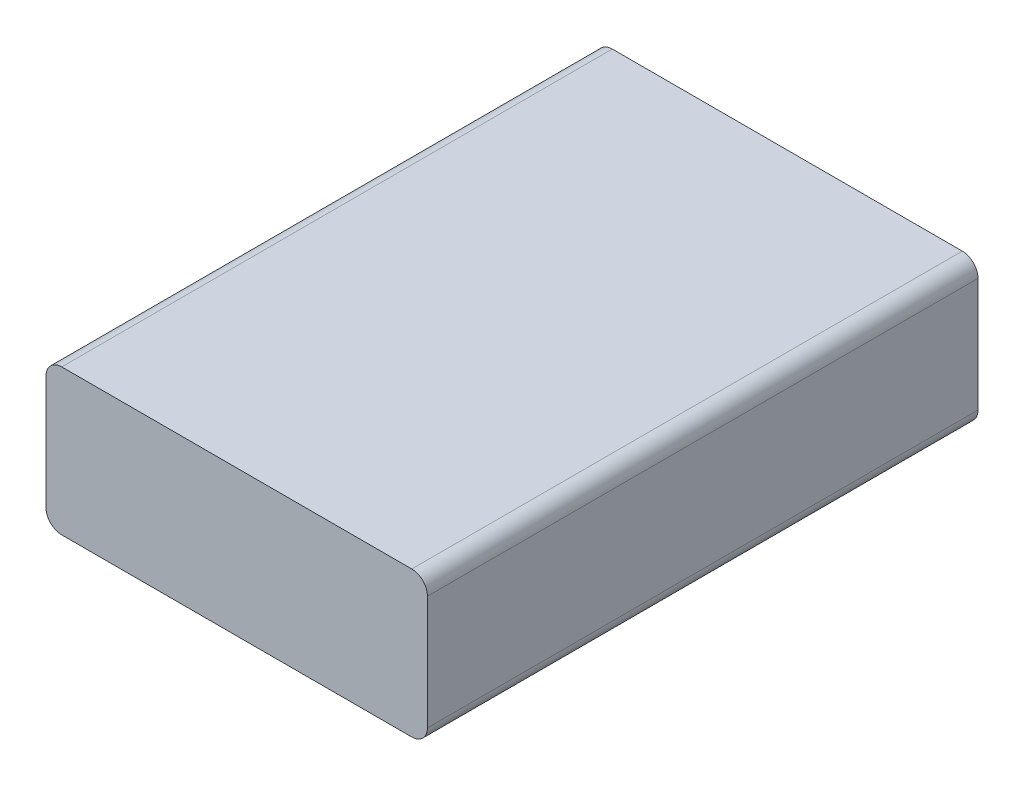
from build123d import *

# Parameters (mm, degrees)
SKETCH1_W           = 48.5
SKETCH1_H           = 70
BOSS_EXTRUDE1_DEPTH = 18.5
FILLET1_R           = 2


with BuildPart() as part:
    # Sketch1 → Boss-Extrude1 (new body)
    with BuildSketch(Plane(origin=(0, 0, 0), x_dir=(1, 0, 0), z_dir=(0, 1, 0))):
        Rectangle(SKETCH1_W, SKETCH1_H)
    extrude(amount=BOSS_EXTRUDE1_DEPTH)

    # Fillet1
    fillet1_edges = [part.edges().sort_by_distance(p)[0] for p in [
        (-24.25, 0, 0),
        (24.25, 0, 0),
        (-24.25, 18.5, 0),
        (24.25, 18.5, 0),
    ]]
    fillet(fillet1_edges, radius=FILLET1_R)


solid = part.part
